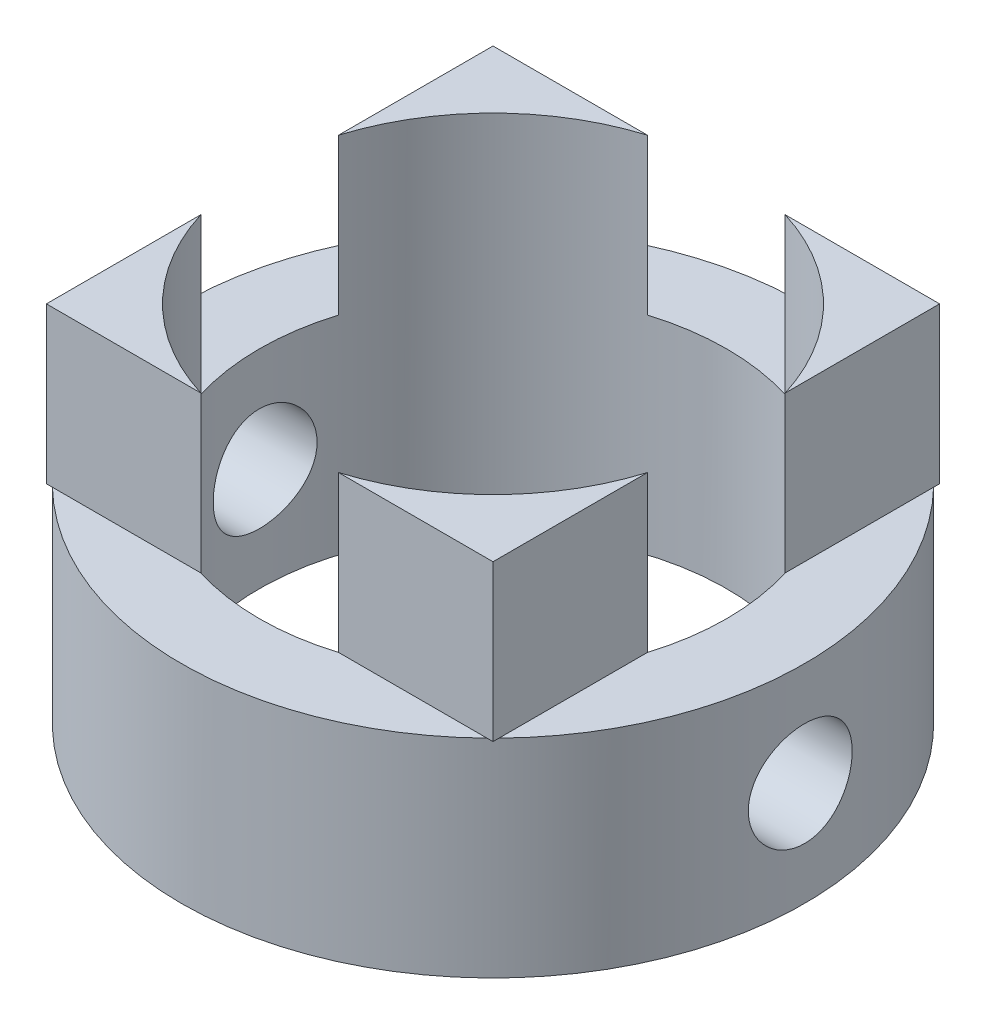
from build123d import *
from build123d.topology import SkipClean

# Parameters (mm, degrees)
SKETCH1_R               = 6
SKETCH1_R_2             = 4.5
BOSS_EXTRUDE5_DEPTH     = 4
BOSS_EXTRUDE6_DEPTH     = 3
CUT_EXTRUDE1_DEPTH      = 12
CUT_EXTRUDE1_DEPTH_BACK = 12
SKETCH4_R               = 1


with BuildPart() as part:
    # Sketch1 → Boss-Extrude5 (new body)
    with BuildSketch(Plane(origin=(0, 0, 0), x_dir=(1, 0, 0), z_dir=(0, 1, 0))):
        Circle(SKETCH1_R)
        Circle(SKETCH1_R_2, mode=Mode.SUBTRACT)
    extrude(amount=BOSS_EXTRUDE5_DEPTH)

    # Sketch3 → Boss-Extrude6 (add)
    with SkipClean():  # the faces are left unmerged after this step: merging them gives an invalid solid
        with BuildSketch(Plane(origin=(0, 4, 0), x_dir=(1, 0, 0), z_dir=(0, 1, 0))):
            with BuildLine():
                Line((1.326649916, 4.3), (4.3, 4.3))
                Line((4.3, 4.3), (4.3, 1.326649916))
                ThreePointArc((4.3, 1.326649916), (3.181980515, 3.181980515), (1.326649916, 4.3))
            make_face()
            with BuildLine():
                Line((-4.3, -4.3), (-1.326649916, -4.3))
                ThreePointArc((-1.326649916, -4.3), (-3.181980515, -3.181980515), (-4.3, -1.326649916))
                Line((-4.3, -1.326649916), (-4.3, -4.3))
            make_face()
            with BuildLine():
                Line((-4.3, 4.3), (-1.326649916, 4.3))
                ThreePointArc((-1.326649916, 4.3), (-3.181980515, 3.181980515), (-4.3, 1.326649916))
                Line((-4.3, 1.326649916), (-4.3, 4.3))
            make_face()
            with BuildLine():
                Line((4.3, -4.3), (4.3, -1.326649916))
                ThreePointArc((4.3, -1.326649916), (3.181980515, -3.181980515), (1.326649916, -4.3))
                Line((1.326649916, -4.3), (4.3, -4.3))
            make_face()
        extrude(amount=BOSS_EXTRUDE6_DEPTH)

    # Sketch4 → Cut-Extrude1 (cut, two sides: drawn at the far end of the back side and taken through both)
    with SkipClean():  # the faces are left unmerged after this step: merging them gives an invalid solid
        with BuildSketch(Plane(origin=(0, 0, 0), x_dir=(0, 0, -1), z_dir=(1, 0, 0)).offset(-CUT_EXTRUDE1_DEPTH_BACK)):
            with Locations((0, 2)):
                Circle(SKETCH4_R)
        extrude(amount=CUT_EXTRUDE1_DEPTH + CUT_EXTRUDE1_DEPTH_BACK, mode=Mode.SUBTRACT)


solid = part.part
